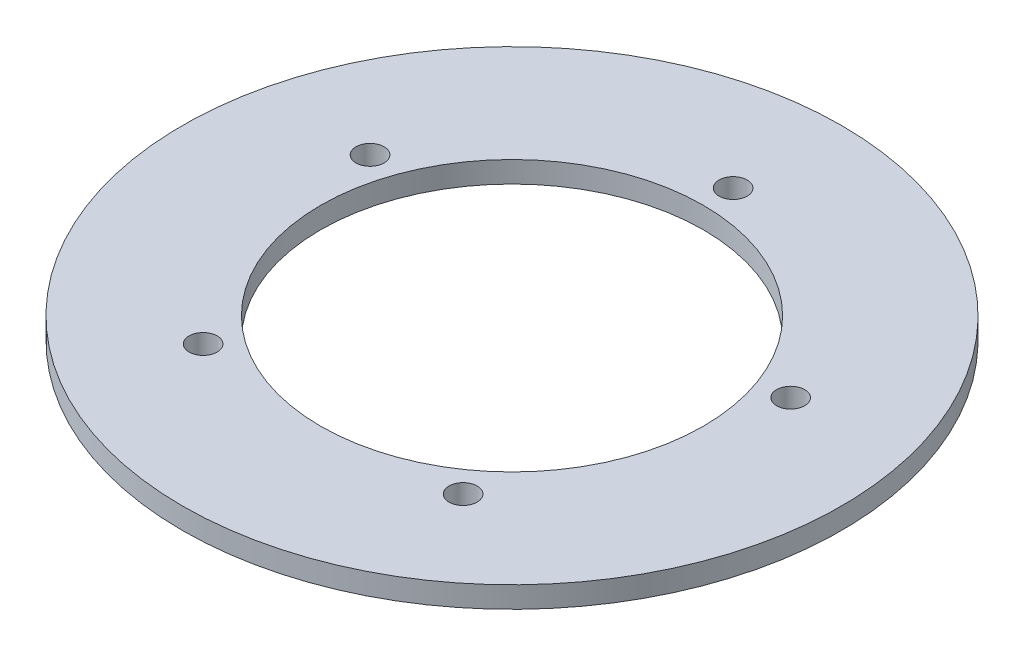
from build123d import *

# Parameters (mm, degrees)
SKETCH1_R            = 77.5
SKETCH1_R_2          = 45
BODY_DEPTH           = 5
M6_CLEARANCE_HOLE1_D = 6.6


with BuildPart() as part:
    # Sketch1 → Body (new body)
    with BuildSketch(Plane(origin=(0, 0, 0), x_dir=(1, 0, 0), z_dir=(0, 1, 0))):
        Circle(SKETCH1_R)
        Circle(SKETCH1_R_2, mode=Mode.SUBTRACT)
    extrude(amount=BODY_DEPTH)

    # M6 Clearance Hole1 (through all)
    with Locations(Plane(origin=(0, 5, 0), x_dir=(1, 0, 0), z_dir=(0, 1, 0))):
        with Locations((0, 52), (49.454938847, 16.068883707), (30.564833119, -42.068883707), (-30.564833119, -42.068883707), (-49.454938847, 16.068883707), (0, 0)):
            Hole(M6_CLEARANCE_HOLE1_D / 2)


solid = part.part
